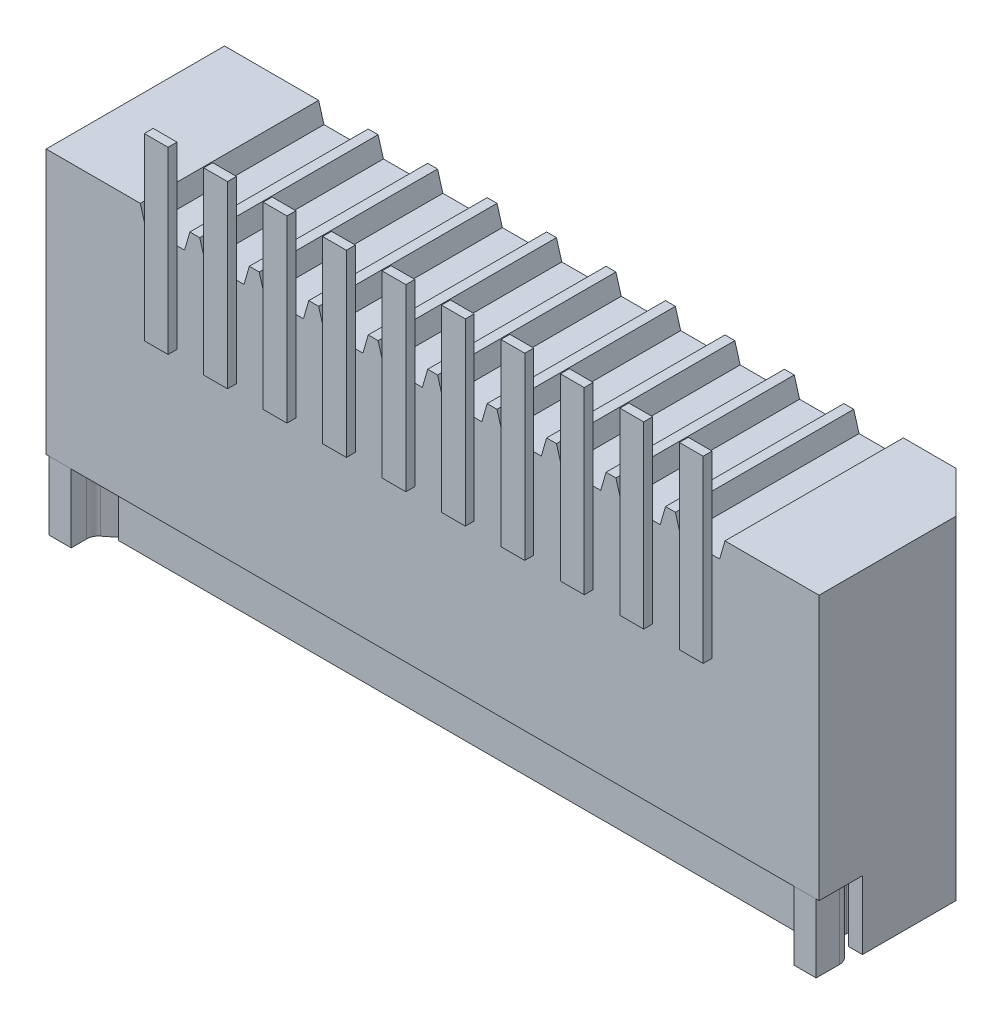
from build123d import *

# Parameters (mm, degrees)
CROQUIS1_W              = 13
CROQUIS1_H              = 5.6
SALIENTE_EXTRUIR1_DEPTH = 3
CHAFL_N1_SIZE           = 0.7
CORTAR_EXTRUIR2_DEPTH   = 3
CROQUIS3_W              = 0.4
CROQUIS3_H              = 3.018594485
SALIENTE_EXTRUIR2_DEPTH = 0.15
CORTAR_EXTRUIR3_DEPTH   = 1.15
CHAFL_N2_SIZE           = 0.1
CHAFL_N3_SIZE           = 0.1
SALIENTE_EXTRUIR3_REACH = 31.269
CROQUIS6_W              = 10.933093566
CROQUIS6_H              = 0.952360067
CORTAR_EXTRUIR4_DEPTH   = 4.15


# Read off the part's stored shape, not the designer's step: Cortar-Extruir2
with BuildPart() as part:
    # Croquis1 → Saliente-Extruir1 (new body)
    with BuildSketch(Plane.XY):
        with Locations((-21.793570969, 13.452377179)):
            Rectangle(CROQUIS1_W, CROQUIS1_H)
    extrude(amount=SALIENTE_EXTRUIR1_DEPTH)

    # Chaflán1
    chafl_n1_edges = [part.edges().sort_by_distance(p)[0] for p in [
        (-15.293570969, 13.452377179, 0),
    ]]
    chamfer(chafl_n1_edges, length=CHAFL_N1_SIZE)

    # Cortar-Extruir2 outline → Cortar-Extruir2 (cut)
    with BuildSketch(Plane.XY):
        Polygon((-17.621115584, 15.943079937), (-16.966026353, 15.943079937), (-16.876645662, 16.252377179), (-17.710496275, 16.252377179), align=None)
        Polygon((-25.966026353, 15.943079937), (-25.876645662, 16.252377179), (-26.710496275, 16.252377179), (-26.621115584, 15.943079937), align=None)
        Polygon((-24.966026353, 15.943079937), (-24.876645662, 16.252377179), (-25.710496275, 16.252377179), (-25.621115584, 15.943079937), align=None)
        Polygon((-23.966026353, 15.943079937), (-23.876645662, 16.252377179), (-24.710496275, 16.252377179), (-24.621115584, 15.943079937), align=None)
        Polygon((-22.966026353, 15.943079937), (-22.876645662, 16.252377179), (-23.710496275, 16.252377179), (-23.621115584, 15.943079937), align=None)
        Polygon((-21.966026353, 15.943079937), (-21.876645662, 16.252377179), (-22.710496275, 16.252377179), (-22.621115584, 15.943079937), align=None)
        Polygon((-20.966026353, 15.943079937), (-20.876645662, 16.252377179), (-21.710496275, 16.252377179), (-21.621115584, 15.943079937), align=None)
        Polygon((-19.966026353, 15.943079937), (-19.876645662, 16.252377179), (-20.710496275, 16.252377179), (-20.621115584, 15.943079937), align=None)
        Polygon((-18.966026353, 15.943079937), (-18.876645662, 16.252377179), (-19.710496275, 16.252377179), (-19.621115584, 15.943079937), align=None)
        Polygon((-17.966026353, 15.943079937), (-17.876645662, 16.252377179), (-18.710496275, 16.252377179), (-18.621115584, 15.943079937), align=None)
    extrude(amount=CORTAR_EXTRUIR2_DEPTH, mode=Mode.SUBTRACT)

    # Croquis3 → Saliente-Extruir2 (add)
    with BuildSketch(Plane.XY.offset(3)):
        with Locations((-22.293570969, 15.943079937)):
            Rectangle(CROQUIS3_W, CROQUIS3_H)
        with Locations((-23.293570969, 15.943079937)):
            Rectangle(CROQUIS3_W, CROQUIS3_H)
        with Locations((-24.293570969, 15.943079937)):
            Rectangle(CROQUIS3_W, CROQUIS3_H)
        with Locations((-25.293570969, 15.943079937)):
            Rectangle(CROQUIS3_W, CROQUIS3_H)
        with Locations((-26.293570969, 15.943079937)):
            Rectangle(CROQUIS3_W, CROQUIS3_H)
        with Locations((-17.293570969, 15.943079937)):
            Rectangle(CROQUIS3_W, CROQUIS3_H)
        with Locations((-18.293570969, 15.943079937)):
            Rectangle(CROQUIS3_W, CROQUIS3_H)
        with Locations((-19.293570969, 15.943079937)):
            Rectangle(CROQUIS3_W, CROQUIS3_H)
        with Locations((-20.293570969, 15.943079937)):
            Rectangle(CROQUIS3_W, CROQUIS3_H)
        with Locations((-21.293570969, 15.943079937)):
            Rectangle(CROQUIS3_W, CROQUIS3_H)
    extrude(amount=SALIENTE_EXTRUIR2_DEPTH)

    # Croquis4 → Cortar-Extruir3 (cut)
    with BuildSketch(Plane(origin=(0, 10.652377179, 0), x_dir=(-1, 0, 0), z_dir=(0, -1, 0))):
        Polygon((28.293570969, -2.270222849), (28.060100208, -2.270222849), (27.932042855, -2.142165496), (27.932042855, -1.288389121), (27.660457603, -1.288389121), (27.481828774, -1.288389121), (27.481828774, -2.592379577), (16.105313164, -2.592379577), (16.105313164, -1.288389121), (15.926684334, -1.288389121), (15.655099082, -1.288389121), (15.655099082, -2.142165496), (15.52704173, -2.270222849), (15.293570969, -2.270222849), (15.293570969, -3), (28.293570969, -3), align=None)
    extrude(amount=-CORTAR_EXTRUIR3_DEPTH, mode=Mode.SUBTRACT)

    # Chaflán2
    chafl_n2_edges = [part.edges().sort_by_distance(p)[0] for p in [
        (-16.105313164, 10.652377179, 1.940384349),
        (-15.880206123, 10.652377179, 1.288389121),
        (-15.655099082, 10.652377179, 1.715277308),
    ]]
    chamfer(chafl_n2_edges, length=CHAFL_N2_SIZE)

    # Chaflán3
    chafl_n3_edges = [part.edges().sort_by_distance(p)[0] for p in [
        (-27.932042855, 10.652377179, 1.715277308),
        (-27.706935814, 10.652377179, 1.288389121),
        (-27.481828774, 10.652377179, 1.940384349),
    ]]
    chamfer(chafl_n3_edges, length=CHAFL_N3_SIZE)


with BuildPart() as body_2:

    # Croquis5 → Saliente-Extruir3 (new, up to next)
    with BuildSketch(Plane(origin=(0, 10.652377179, 0), x_dir=(-1, 0, 0), z_dir=(0, -1, 0)), mode=Mode.PRIVATE) as saliente_extruir3_sk1:
        with BuildLine():
            Line((27.872382829, -1.354074939), (27.547270219, -1.354074939))
            Line((27.547270219, -1.354074939), (27.547270219, -2.286488047))
            ThreePointArc((27.547270219, -2.286488047), (27.567009571, -2.373125793), (27.622331209, -2.442661809))
            Line((27.622331209, -2.442661809), (27.797321839, -2.582654313))
            ThreePointArc((27.797321839, -2.582654313), (27.852643477, -2.652190329), (27.872382829, -2.738828075))
            Line((27.872382829, -2.738828075), (27.872382829, -3))
            Line((27.872382829, -3), (28.244784547, -3))
            Line((28.244784547, -3), (28.244784547, -2.608783031))
            ThreePointArc((28.244784547, -2.608783031), (28.225045195, -2.522145284), (28.169723557, -2.452609269))
            Line((28.169723557, -2.452609269), (27.930588125, -2.261300923))
            ThreePointArc((27.930588125, -2.261300923), (27.874302968, -2.189730953), (27.855577786, -2.100626255))
            Line((27.855577786, -2.100626255), (27.872382829, -1.354074939))
        make_face()
    saliente_extruir3_tool1 = extrude(saliente_extruir3_sk1.sketch, amount=-SALIENTE_EXTRUIR3_REACH, mode=Mode.PRIVATE) - part.part
    # Croquis5 → Saliente-Extruir3 (new, up to next)
    with BuildSketch(Plane(origin=(0, 10.652377179, 0), x_dir=(-1, 0, 0), z_dir=(0, -1, 0)), mode=Mode.PRIVATE) as saliente_extruir3_sk2:
        with BuildLine():
            Line((15.731564151, -2.100626255), (15.714759108, -1.354074939))
            Line((15.714759108, -1.354074939), (16.039871719, -1.354074939))
            Line((16.039871719, -1.354074939), (16.039871719, -2.286488047))
            ThreePointArc((16.039871719, -2.286488047), (16.020132366, -2.373125793), (15.964810728, -2.442661809))
            Line((15.964810728, -2.442661809), (15.789820098, -2.582654313))
            ThreePointArc((15.789820098, -2.582654313), (15.734498461, -2.652190329), (15.714759108, -2.738828075))
            Line((15.714759108, -2.738828075), (15.714759108, -3))
            Line((15.714759108, -3), (15.34235739, -3))
            Line((15.34235739, -3), (15.34235739, -2.608783031))
            ThreePointArc((15.34235739, -2.608783031), (15.362096743, -2.522145284), (15.417418381, -2.452609269))
            Line((15.417418381, -2.452609269), (15.656553813, -2.261300923))
            ThreePointArc((15.656553813, -2.261300923), (15.712838969, -2.189730953), (15.731564151, -2.100626255))
        make_face()
    saliente_extruir3_tool2 = extrude(saliente_extruir3_sk2.sketch, amount=-SALIENTE_EXTRUIR3_REACH, mode=Mode.PRIVATE) - part.part
    add(saliente_extruir3_tool1.solids().sort_by_distance((-27.842173, 10.652377, 2.225572))[0])
    add(saliente_extruir3_tool2.solids().sort_by_distance((-15.744969, 10.652377, 2.225572))[0])


with BuildPart() as part_1:
    add(part.part)

    # Croquis6 → Cortar-Extruir4 (cut)
    with BuildSketch(Plane(origin=(0, 10.652377179, 0), x_dir=(-1, 0, 0), z_dir=(0, -1, 0))):
        with Locations((21.793570969, -1.813090017)):
            Rectangle(CROQUIS6_W, CROQUIS6_H)
    extrude(amount=-CORTAR_EXTRUIR4_DEPTH, mode=Mode.SUBTRACT)

    # Chaflán4
    # the kernel refuses this chamfer: 0.4 mm, written as the material it takes off along each edge
    with BuildSketch(Plane(origin=(-16.327024186, 10.652377179, 1.336909983), x_dir=(0.9996219169112966, -0.027495876610587302, 0), z_dir=(0, 0, 1)), Plane(origin=(-27.260117752, 10.652377179, 2.28927005), x_dir=(-0.9996219169112966, -0.02749587661058742, 0), z_dir=(0, 0, -1))) as chafl_n4_piece_1:
        with BuildLine():
            Line((0.411469278, 0), (-0.022618862, 0.410847117))
            Line((-0.022618862, 0.410847117), (-0.030615837, 0.41062715))
            ThreePointArc((-0.030615837, 0.41062715), (-0.013651691, 0.205359132), (-0.007996975, -0.000219967))
            Line((-0.007996975, -0.000219967), (0.000219967, -0.007996975))
            ThreePointArc((0.000219967, -0.007996975), (0.205799066, -0.00234226), (0.411689245, -0.007996975))
            Line((0.411689245, -0.007996975), (0.411469278, 0))
        make_face()
    extrude(amount=0.952360067, mode=Mode.SUBTRACT)
    with BuildSketch(Plane(origin=(-16.327024186, 10.652377179, 2.28927005), x_dir=(0, -0.02749587661058736, 0.9996219169112966), z_dir=(-1, 0, 0)), Plane(origin=(-27.260117752, 10.652377179, 1.336909983), x_dir=(0, -0.027495876610587354, -0.9996219169112966), z_dir=(1, 0, 0))) as chafl_n4_piece_2:
        with BuildLine():
            Line((0.411469278, 0), (-0.022618862, 0.410847117))
            Line((-0.022618862, 0.410847117), (-0.030615837, 0.41062715))
            ThreePointArc((-0.030615837, 0.41062715), (-0.013651691, 0.205359132), (-0.007996975, -0.000219967))
            Line((-0.007996975, -0.000219967), (0.000219967, -0.007996975))
            ThreePointArc((0.000219967, -0.007996975), (0.205799066, -0.00234226), (0.411689245, -0.007996975))
            Line((0.411689245, -0.007996975), (0.411469278, 0))
        make_face()
    extrude(amount=10.933093566, mode=Mode.SUBTRACT)
    with BuildSketch(Plane(origin=(-27.260117752, 10.652377179, 1.336909983), x_dir=(0, -0.027495876610587354, -0.9996219169112966), z_dir=(1, 0, 0))) as chafl_n4_piece_3a_section:
        with BuildLine():
            Line((0.411469278, 0), (-0.022618862, 0.410847117))
            Line((-0.022618862, 0.410847117), (-0.030615837, 0.41062715))
            ThreePointArc((-0.030615837, 0.41062715), (-0.013651691, 0.205359132), (-0.007996975, -0.000219967))
            Line((-0.007996975, -0.000219967), (0.000219967, -0.007996975))
            ThreePointArc((0.000219967, -0.007996975), (0.205799066, -0.00234226), (0.411689245, -0.007996975))
            Line((0.411689245, -0.007996975), (0.411469278, 0))
        make_face()
    chafl_n4_piece_3a = extrude(amount=11.961766761, mode=Mode.PRIVATE)
    chafl_n4_piece_3a = split(chafl_n4_piece_3a, bisect_by=Plane(origin=(-16.327024186, 10.78429463, 1.204992533), z_dir=(1, 0, 0)), keep=Keep.TOP, mode=Mode.PRIVATE)
    with BuildSketch(Plane(origin=(-16.327024186, 10.652377179, 0.308236788), x_dir=(0.9996219169112966, -0.027495876610587302, 0), z_dir=(0, 0, 1))) as chafl_n4_piece_3b_section:
        with BuildLine():
            Line((0.411469278, 0), (-0.022618862, 0.410847117))
            Line((-0.022618862, 0.410847117), (-0.030615837, 0.41062715))
            ThreePointArc((-0.030615837, 0.41062715), (-0.013651691, 0.205359132), (-0.007996975, -0.000219967))
            Line((-0.007996975, -0.000219967), (0.000219967, -0.007996975))
            ThreePointArc((0.000219967, -0.007996975), (0.205799066, -0.00234226), (0.411689245, -0.007996975))
            Line((0.411689245, -0.007996975), (0.411469278, 0))
        make_face()
    chafl_n4_piece_3b = extrude(amount=1.981033262, mode=Mode.PRIVATE)
    chafl_n4_piece_3b = split(chafl_n4_piece_3b, bisect_by=Plane(origin=(-16.195106735, 10.78429463, 1.336909983), z_dir=(0, 0, -1)), keep=Keep.TOP, mode=Mode.PRIVATE)
    chafl_n4_piece_3 = chafl_n4_piece_3a & chafl_n4_piece_3b
    add(chafl_n4_piece_3, mode=Mode.SUBTRACT)
    with BuildSketch(Plane(origin=(-15.298350991, 10.652377179, 2.28927005), x_dir=(0, -0.02749587661058736, 0.9996219169112966), z_dir=(-1, 0, 0))) as chafl_n4_piece_4a_section:
        with BuildLine():
            Line((0.411469278, 0), (-0.022618862, 0.410847117))
            Line((-0.022618862, 0.410847117), (-0.030615837, 0.41062715))
            ThreePointArc((-0.030615837, 0.41062715), (-0.013651691, 0.205359132), (-0.007996975, -0.000219967))
            Line((-0.007996975, -0.000219967), (0.000219967, -0.007996975))
            ThreePointArc((0.000219967, -0.007996975), (0.205799066, -0.00234226), (0.411689245, -0.007996975))
            Line((0.411689245, -0.007996975), (0.411469278, 0))
        make_face()
    chafl_n4_piece_4a = extrude(amount=11.961766761, mode=Mode.PRIVATE)
    chafl_n4_piece_4a = split(chafl_n4_piece_4a, bisect_by=Plane(origin=(-16.327024186, 10.78429463, 2.421187501), z_dir=(1, 0, 0)), keep=Keep.TOP, mode=Mode.PRIVATE)
    with BuildSketch(Plane(origin=(-16.327024186, 10.652377179, 1.336909983), x_dir=(0.9996219169112966, -0.027495876610587302, 0), z_dir=(0, 0, 1))) as chafl_n4_piece_4b_section:
        with BuildLine():
            Line((0.411469278, 0), (-0.022618862, 0.410847117))
            Line((-0.022618862, 0.410847117), (-0.030615837, 0.41062715))
            ThreePointArc((-0.030615837, 0.41062715), (-0.013651691, 0.205359132), (-0.007996975, -0.000219967))
            Line((-0.007996975, -0.000219967), (0.000219967, -0.007996975))
            ThreePointArc((0.000219967, -0.007996975), (0.205799066, -0.00234226), (0.411689245, -0.007996975))
            Line((0.411689245, -0.007996975), (0.411469278, 0))
        make_face()
    chafl_n4_piece_4b = extrude(amount=1.981033262, mode=Mode.PRIVATE)
    chafl_n4_piece_4b = split(chafl_n4_piece_4b, bisect_by=Plane(origin=(-16.195106735, 10.78429463, 2.28927005), z_dir=(0, 0, 1)), keep=Keep.TOP, mode=Mode.PRIVATE)
    chafl_n4_piece_4 = chafl_n4_piece_4a & chafl_n4_piece_4b
    add(chafl_n4_piece_4, mode=Mode.SUBTRACT)
    with BuildSketch(Plane(origin=(-16.327024186, 10.652377179, 2.28927005), x_dir=(0, -0.02749587661058736, 0.9996219169112966), z_dir=(-1, 0, 0))) as chafl_n4_piece_5a_section:
        with BuildLine():
            Line((0.411469278, 0), (-0.022618862, 0.410847117))
            Line((-0.022618862, 0.410847117), (-0.030615837, 0.41062715))
            ThreePointArc((-0.030615837, 0.41062715), (-0.013651691, 0.205359132), (-0.007996975, -0.000219967))
            Line((-0.007996975, -0.000219967), (0.000219967, -0.007996975))
            ThreePointArc((0.000219967, -0.007996975), (0.205799066, -0.00234226), (0.411689245, -0.007996975))
            Line((0.411689245, -0.007996975), (0.411469278, 0))
        make_face()
    chafl_n4_piece_5a = extrude(amount=11.961766761, mode=Mode.PRIVATE)
    chafl_n4_piece_5a = split(chafl_n4_piece_5a, bisect_by=Plane(origin=(-27.260117752, 10.78429463, 2.421187501), z_dir=(-1, 0, 0)), keep=Keep.TOP, mode=Mode.PRIVATE)
    with BuildSketch(Plane(origin=(-27.260117752, 10.652377179, 3.317943245), x_dir=(-0.9996219169112966, -0.02749587661058742, 0), z_dir=(0, 0, -1))) as chafl_n4_piece_5b_section:
        with BuildLine():
            Line((0.411469278, 0), (-0.022618862, 0.410847117))
            Line((-0.022618862, 0.410847117), (-0.030615837, 0.41062715))
            ThreePointArc((-0.030615837, 0.41062715), (-0.013651691, 0.205359132), (-0.007996975, -0.000219967))
            Line((-0.007996975, -0.000219967), (0.000219967, -0.007996975))
            ThreePointArc((0.000219967, -0.007996975), (0.205799066, -0.00234226), (0.411689245, -0.007996975))
            Line((0.411689245, -0.007996975), (0.411469278, 0))
        make_face()
    chafl_n4_piece_5b = extrude(amount=1.981033262, mode=Mode.PRIVATE)
    chafl_n4_piece_5b = split(chafl_n4_piece_5b, bisect_by=Plane(origin=(-27.392035202, 10.78429463, 2.28927005), z_dir=(0, 0, 1)), keep=Keep.TOP, mode=Mode.PRIVATE)
    chafl_n4_piece_5 = chafl_n4_piece_5a & chafl_n4_piece_5b
    add(chafl_n4_piece_5, mode=Mode.SUBTRACT)
    with BuildSketch(Plane(origin=(-27.260117752, 10.652377179, 2.28927005), x_dir=(-0.9996219169112966, -0.02749587661058742, 0), z_dir=(0, 0, -1))) as chafl_n4_piece_6a_section:
        with BuildLine():
            Line((0.411469278, 0), (-0.022618862, 0.410847117))
            Line((-0.022618862, 0.410847117), (-0.030615837, 0.41062715))
            ThreePointArc((-0.030615837, 0.41062715), (-0.013651691, 0.205359132), (-0.007996975, -0.000219967))
            Line((-0.007996975, -0.000219967), (0.000219967, -0.007996975))
            ThreePointArc((0.000219967, -0.007996975), (0.205799066, -0.00234226), (0.411689245, -0.007996975))
            Line((0.411689245, -0.007996975), (0.411469278, 0))
        make_face()
    chafl_n4_piece_6a = extrude(amount=1.981033262, mode=Mode.PRIVATE)
    chafl_n4_piece_6a = split(chafl_n4_piece_6a, bisect_by=Plane(origin=(-27.392035202, 10.78429463, 1.336909983), z_dir=(0, 0, -1)), keep=Keep.TOP, mode=Mode.PRIVATE)
    with BuildSketch(Plane(origin=(-28.288790947, 10.652377179, 1.336909983), x_dir=(0, -0.027495876610587354, -0.9996219169112966), z_dir=(1, 0, 0))) as chafl_n4_piece_6b_section:
        with BuildLine():
            Line((0.411469278, 0), (-0.022618862, 0.410847117))
            Line((-0.022618862, 0.410847117), (-0.030615837, 0.41062715))
            ThreePointArc((-0.030615837, 0.41062715), (-0.013651691, 0.205359132), (-0.007996975, -0.000219967))
            Line((-0.007996975, -0.000219967), (0.000219967, -0.007996975))
            ThreePointArc((0.000219967, -0.007996975), (0.205799066, -0.00234226), (0.411689245, -0.007996975))
            Line((0.411689245, -0.007996975), (0.411469278, 0))
        make_face()
    chafl_n4_piece_6b = extrude(amount=11.961766761, mode=Mode.PRIVATE)
    chafl_n4_piece_6b = split(chafl_n4_piece_6b, bisect_by=Plane(origin=(-27.260117752, 10.78429463, 1.204992533), z_dir=(-1, 0, 0)), keep=Keep.TOP, mode=Mode.PRIVATE)
    chafl_n4_piece_6 = chafl_n4_piece_6a & chafl_n4_piece_6b
    add(chafl_n4_piece_6, mode=Mode.SUBTRACT)


solid = Compound([body_2.part, part_1.part])
